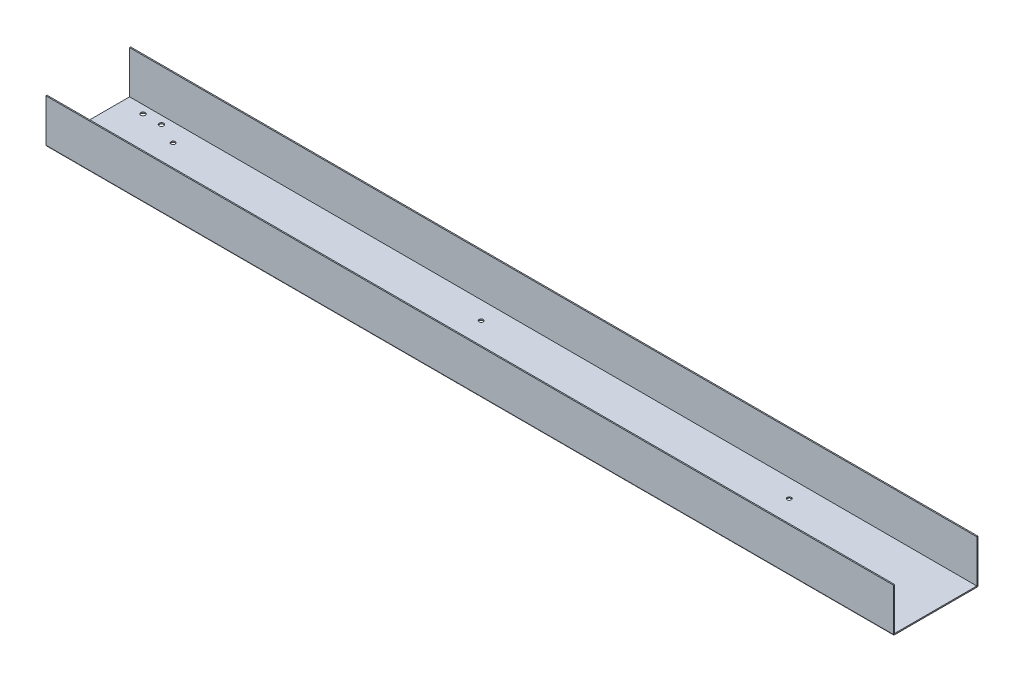
from build123d import *

# Parameters (mm, degrees)
CROQUIS1_W                      = 1100
CROQUIS1_H                      = 220
BRIDA_BASE1_DEPTH               = 1.5
PLIEGUE_START                   = -592.530487805
PLIEGUE_CROQUIZADO1_DEPTH       = 1100
PLIEGUE_CROQUIZADO1_2_OUTLINE_W = 55.321902755
PLIEGUE_CROQUIZADO1_2_OUTLINE_H = 1.5
PLIEGUE_CROQUIZADO1_2_DEPTH     = 1100
CROQUIS8_R                      = 3
CORTAR_EXTRUIR1_DEPTH           = 10
TALADRO_DE_MARGEN_PARA_M51_D    = 5.5


# Read off the part's stored shape, not the designer's step: Pliegue croquizado1
# Sheet-metal steps are written as plain solids
with BuildPart() as part:
    # Croquis1 → Brida base1 (new body)
    with BuildSketch(Plane(origin=(0, 0, 0), x_dir=(1, 0, 0), z_dir=(0, 1, 0))):
        with Locations((-42.530487805, -13.391768293)):
            Rectangle(CROQUIS1_W, CROQUIS1_H)
    extrude(amount=-BRIDA_BASE1_DEPTH)

    # Pliegue croquizado1 outline → Pliegue croquizado1 (cut)
    with BuildSketch(Plane.YZ.offset(PLIEGUE_START)):
        with BuildLine():
            Line((0, -96.608231707), (0, -41.608231707))
            ThreePointArc((0, -41.608231707), (-1.060660172, -41.168891879), (-1.5, -40.108231707))
            Line((-1.5, -40.108231707), (-1.5, -96.608231707))
            Line((-1.5, -96.608231707), (0, -96.608231707))
        make_face()
        with BuildLine():
            Line((-1.5, 123.391768293), (-1.5, 66.891768293))
            ThreePointArc((-1.5, 66.891768293), (-1.060660171, 67.952428465), (0, 68.391768293))
            Line((0, 68.391768293), (0, 123.391768293))
            Line((0, 123.391768293), (-1.5, 123.391768293))
        make_face()
    extrude(amount=PLIEGUE_CROQUIZADO1_DEPTH, mode=Mode.SUBTRACT)

    # Pliegue croquizado1 2 outline → Pliegue croquizado1 2 (add)
    with BuildSketch(Plane.YZ.offset(PLIEGUE_START)):
        with Locations((27.660951378, -40.858231707)):
            Rectangle(PLIEGUE_CROQUIZADO1_2_OUTLINE_W, PLIEGUE_CROQUIZADO1_2_OUTLINE_H)
        with Locations((27.660951378, 67.641768293)):
            Rectangle(PLIEGUE_CROQUIZADO1_2_OUTLINE_W, PLIEGUE_CROQUIZADO1_2_OUTLINE_H)
    extrude(amount=PLIEGUE_CROQUIZADO1_2_DEPTH)

    # Croquis8 → Cortar-Extruir1 (cut)
    with BuildSketch(Plane(origin=(0, 0, 0), x_dir=(1, 0, 0), z_dir=(0, 1, 0))):
        with Locations(Location((-564.580402517, -56.391768293, 0), (0, 0, 270))):
            Circle(CROQUIS8_R)
        with Locations(Location((-540.580402517, -56.391768293, 0), (0, 0, 270))):
            Circle(CROQUIS8_R)
        with Locations(Location((-540.580402517, 29.608231707, 0), (0, 0, 270))):
            Circle(CROQUIS8_R)
        with Locations(Location((-564.580402517, 29.608231707, 0), (0, 0, 270))):
            Circle(CROQUIS8_R)
    extrude(amount=-CORTAR_EXTRUIR1_DEPTH, mode=Mode.SUBTRACT)

    # Taladro de margen para M51 (through all)
    with Locations(Plane(origin=(0, 0, 0), x_dir=(1, 0, 0), z_dir=(0, 1, 0))):
        with Locations((-512.530487805, -43.391768293), (-512.530487805, 16.608231707), (-112.530487805, -43.391768293), (-112.530487805, 16.608231707), (287.469512195, -43.391768293), (287.469512195, 16.608231707)):
            Hole(TALADRO_DE_MARGEN_PARA_M51_D / 2)


solid = part.part
